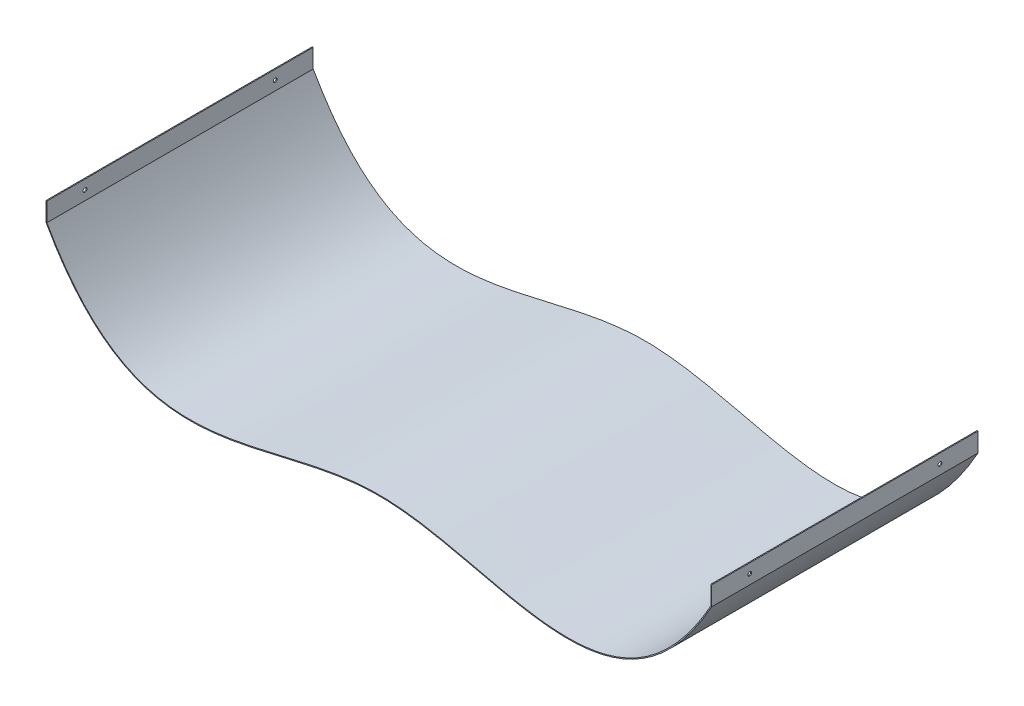
from build123d import *

# Parameters (mm, degrees)
EXTRUIR_L_MINA1_DEPTH = 280
CROQUIS2_R            = 2
CORTAR_EXTRUIR1_DEPTH = 1
CORTAR_EXTRUIR2_START = -1
CROQUIS3_R            = 2
CORTAR_EXTRUIR2_DEPTH = 1


# Read off the part's stored shape, not the designer's step: Extruir-Lámina1
with BuildPart() as part:
    # Extruir-Lámina1 outline → Extruir-Lámina1 (new body)
    with BuildSketch(Plane.XY):
        with BuildLine():
            Line((350, 90), (350, 110))
            Line((350, 110), (349, 110))
            Line((349, 110), (349, 90.260511983))
            add(Edge.make_bspline(
                [(-349, 90.260511983), (-336.473123725, 67.866744435), (-323.579857538, 49.945026129), (-297.171063329, 21.502335818), (-283.657179578, 10.980597978), (-256.08862116, -4.229610631), (-242.031723713, -8.920140346), (-213.417998998, -14.003988921), (-198.860178523, -14.395291938), (-169.323386859, -12.380030559), (-154.345642249, -9.973049186), (-124.072626635, -3.876504048), (-108.777695252, -0.187186876), (-77.968981739, 6.945990423), (-62.455111312, 10.389870381), (-31.300170229, 15.496875407), (-15.658565807, 17.160093585), (15.658565807, 17.160093585), (31.300170229, 15.496875407), (62.455111312, 10.389870381), (77.968981739, 6.945990423), (108.777695252, -0.187186876), (124.072626635, -3.876504048), (154.345642249, -9.973049186), (169.323386859, -12.380030559), (198.860178523, -14.395291938), (213.417998998, -14.003988921), (242.031723713, -8.920140346), (256.08862116, -4.229610631), (283.657179578, 10.980597978), (297.171063329, 21.502335818), (323.579857538, 49.945026129), (336.473123725, 67.866744435), (349, 90.260511983)],
                knots=[0, 0, 0, 0, 0.0625, 0.0625, 0.125, 0.125, 0.1875, 0.1875, 0.25, 0.25, 0.3125, 0.3125, 0.375, 0.375, 0.4375, 0.4375, 0.5, 0.5, 0.5625, 0.5625, 0.625, 0.625, 0.6875, 0.6875, 0.75, 0.75, 0.8125, 0.8125, 0.875, 0.875, 0.9375, 0.9375, 1, 1, 1, 1], degree=3))
            Line((-349, 90.260511983), (-349, 110))
            Line((-349, 110), (-350, 110))
            Line((-350, 110), (-350, 90))
            add(Edge.make_bspline(
                [(-350, 90), (-249.509090089, -89.921344309), (0, 122.241531478), (249.509090089, -89.921344309), (350, 90)],
                knots=[0, 0, 0, 0, 0.5, 1, 1, 1, 1], degree=3))
        make_face()
    extrude(amount=EXTRUIR_L_MINA1_DEPTH)

    # Croquis2 → Cortar-Extruir1 (cut)
    with BuildSketch(Plane(origin=(-349, 0, 0), x_dir=(0, 0, -1), z_dir=(1, 0, 0))):
        with Locations((-240, 100)):
            Circle(CROQUIS2_R)
        with Locations((-40, 100)):
            Circle(CROQUIS2_R)
    extrude(amount=-CORTAR_EXTRUIR1_DEPTH, mode=Mode.SUBTRACT)

    # Croquis3 → Cortar-Extruir2 (cut)
    with BuildSketch(Plane.ZY.offset(-349).offset(CORTAR_EXTRUIR2_START)):
        with Locations(Location((40, 100, 0), (0, 0, 180))):
            Circle(CROQUIS3_R)
        with Locations(Location((240, 100, 0), (0, 0, 180))):
            Circle(CROQUIS3_R)
    extrude(amount=CORTAR_EXTRUIR2_DEPTH, mode=Mode.SUBTRACT)


solid = part.part
